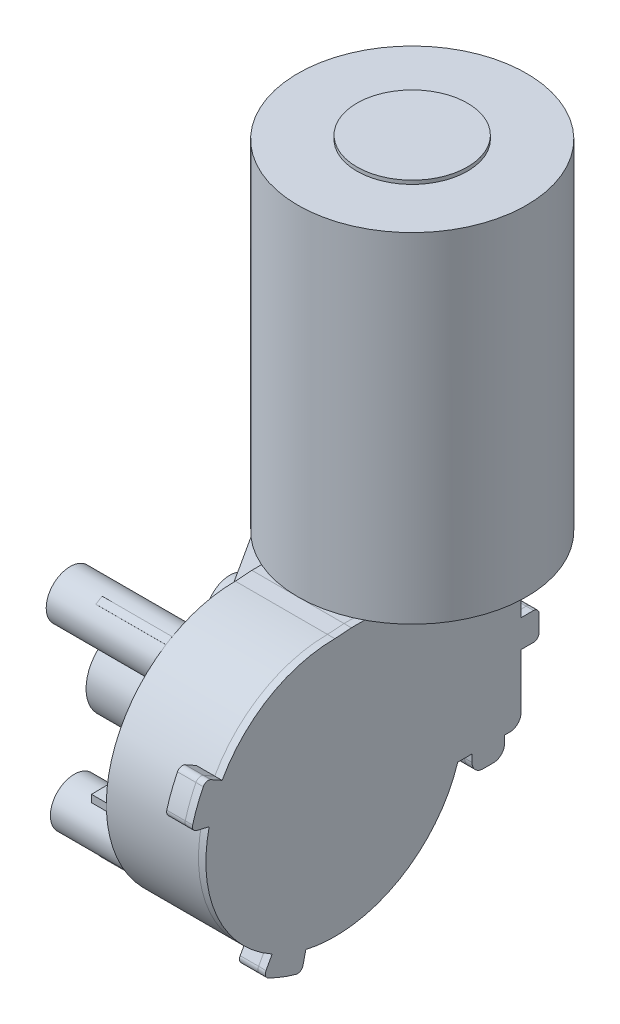
from build123d import *

# Parameters (mm, degrees)
ESBO_O2_R                     = 15
RESSALTO_EXTRUS_O1_DEPTH      = 1
EXTRUS_O_FINA2_OUTLINE_R      = 15
EXTRUS_O_FINA2_DEPTH          = 2
EXTRUS_O_FINA2_START          = 6
EXTRUS_O_FINA2_2_OUTLINE_R    = 15
EXTRUS_O_FINA2_2_DEPTH        = 2
EXTRUS_O_FINA2_START_2        = 2
EXTRUS_O_FINA2_3_OUTLINE_R    = 15
EXTRUS_O_FINA2_3_OUTLINE_R_2  = 13
EXTRUS_O_FINA2_3_DEPTH        = 4
RESSALTO_EXTRUS_O2_DEPTH      = 12.5
RESSALTO_EXTRUS_O2_DEPTH_BACK = 12.5
FILETE1_R                     = 15
ESBO_O6_R                     = 27
ESBO_O6_R_2                   = 25
EXTRUS_O_FINA3_DEPTH          = 4
ESBO_O7_R                     = 3
RESSALTO_EXTRUS_O3_DEPTH      = 4
EXTRUS_O_FINA4_DEPTH          = 4
PADR_OCIRCULAR1_COUNT         = 3
ESBO_O9_R                     = 10.5
RESSALTO_EXTRUS_O4_DEPTH      = 30
EXTRUS_O_FINA6_DEPTH          = 19
PADR_OCIRCULAR2_COUNT         = 3
ESBO_O11_R                    = 6.5
RESSALTO_EXTRUS_O6_DEPTH      = 30
ESBO_O16_R                    = 2.5
CORTE_EXTRUS_O2_DEPTH         = 25
RESSALTO_EXTRUS_O7_DEPTH      = 8
RESSALTO_EXTRUS_O7_DEPTH_BACK = 8
ESBO_O18_W                    = 17.091464814
ESBO_O18_H                    = 8.826934747
RESSALTO_EXTRUS_O8_DEPTH      = 5
FILETE2_R                     = 5
FILETE3_R                     = 3
FILETE4_R                     = 3
ESBO_O19_R                    = 2
CORTE_EXTRUS_O3_DEPTH         = 5
RESSALTO_EXTRUS_O10_START     = -5
RESSALTO_EXTRUS_O10_DEPTH     = 5
FILETE5_R                     = 1.5
ESBO_O21_W                    = 5
ESBO_O21_H                    = 7.5
RESSALTO_EXTRUS_O11_DEPTH     = 5
FILETE6_R                     = 1.5
RESSALTO_EXTRUS_O12_DEPTH     = 2
ESBO_O23_R                    = 5
CORTE_EXTRUS_O4_DEPTH         = 42


# Read off the part's stored shape, not the designer's step: Extrusão-Fina1, Extrusão-Fina2
with BuildPart() as part:
    # Extrusão-Fina1 outline → Extrusão-Fina1 (revolve)
    with BuildSketch(Plane.XY):
        Polygon((31, 92), (0, 92), (0, 82), (29, 82), (29, 10), (0, 10), (0, 0), (31, 0), align=None)
    revolve(axis=Axis((0, 0, 0), (0, 1, 0)))

    # Esboço2 → Ressalto-extrusão1 (add)
    with BuildSketch(Plane(origin=(0, 92, 0), x_dir=(1, 0, 0), z_dir=(0, 1, 0))):
        with Locations(Location((0, 0, 0), (0, 0, 270))):
            Circle(ESBO_O2_R)
    extrude(amount=RESSALTO_EXTRUS_O1_DEPTH)

    # Extrusão-Fina2 outline → Extrusão-Fina2 (add)
    with BuildSketch(Plane.XZ):
        Circle(EXTRUS_O_FINA2_OUTLINE_R)
    extrude(amount=EXTRUS_O_FINA2_DEPTH)



with BuildPart() as body_2:
    # Extrus_o-Fina2 2 outline → Extrus_o-Fina2 2 (new body)
    with BuildSketch(Plane.XZ.offset(EXTRUS_O_FINA2_START)):
        Circle(EXTRUS_O_FINA2_2_OUTLINE_R)
    extrude(amount=EXTRUS_O_FINA2_2_DEPTH)


with BuildPart() as part_1:
    add(part.part)

    add(body_2.part)  # Extrus_o-Fina2 3 merges body 2
    # Extrus_o-Fina2 3 outline → Extrus_o-Fina2 3 (add)
    with BuildSketch(Plane.XZ.offset(EXTRUS_O_FINA2_START_2)):
        Circle(EXTRUS_O_FINA2_3_OUTLINE_R)
        Circle(EXTRUS_O_FINA2_3_OUTLINE_R_2, mode=Mode.SUBTRACT)
    extrude(amount=EXTRUS_O_FINA2_3_DEPTH)

    # Esboço5 → Ressalto-extrusão2 (add, two sides: drawn at the far end of the back side and taken through both)
    with BuildSketch(Plane(origin=(0, 0, 0), x_dir=(0, 0, -1), z_dir=(1, 0, 0)).offset(-RESSALTO_EXTRUS_O2_DEPTH_BACK)):
        with BuildLine():
            Line((15, 0), (15, -46))
            Line((15, -46), (-2.140030554, -46))
            ThreePointArc((-2.140030554, -46), (-63.744394689, -55.946308734), (-35.469913586, -0.317355334))
            Line((-35.469913586, -0.317355334), (-31, 0))
            Line((-31, 0), (15, 0))
        make_face()
    extrude(amount=RESSALTO_EXTRUS_O2_DEPTH + RESSALTO_EXTRUS_O2_DEPTH_BACK)

    # Filete1
    # the kernel refuses this fillet: 15 mm, written as the material it takes off along each edge
    with BuildSketch(Plane(origin=(-12.5, 0, -15), x_dir=(0, 0, 1), z_dir=(0, -1, 0))) as filete1_piece_1_section:
        with BuildLine():
            CenterArc((FILETE1_R, -FILETE1_R), FILETE1_R, 90, 90)
            Line((0, -FILETE1_R), (0, 0))
            Line((0, 0), (FILETE1_R, 0))
        make_face()
    filete1_piece_1 = extrude(amount=83.5, mode=Mode.PRIVATE)
    filete1_piece_1 = filete1_piece_1 - Plane(origin=(0, -1, 0), x_dir=(1, 0, 0), z_dir=(0, 1, 0)) * Cylinder(15, 227, mode=Mode.PRIVATE)
    add(filete1_piece_1, mode=Mode.SUBTRACT)
    with BuildSketch(Plane(origin=(-12.5, 37.5, -15), x_dir=(0, 0, 1), z_dir=(0, -1, 0))) as filete1_piece_2_section:
        with BuildLine():
            CenterArc((FILETE1_R, -FILETE1_R), FILETE1_R, 90, 90)
            Line((0, -FILETE1_R), (0, 0))
            Line((0, 0), (FILETE1_R, 0))
        make_face()
    filete1_piece_2 = extrude(amount=121, mode=Mode.PRIVATE)
    filete1_piece_2 = split(filete1_piece_2, bisect_by=Plane(origin=(-11.836709573, -8, -4.574034317), z_dir=(0, -1, 0)), keep=Keep.TOP, mode=Mode.PRIVATE)
    add(filete1_piece_2, mode=Mode.SUBTRACT)

    # Esboço6 → Extrusão-Fina3 (add)
    with BuildSketch(Plane.ZY.offset(12.5)):
        with Locations((35.469913586, -35.317355334)):
            Circle(ESBO_O6_R)
        with Locations((35.469913586, -35.317355334)):
            Circle(ESBO_O6_R_2, mode=Mode.SUBTRACT)
    extrude(amount=EXTRUS_O_FINA3_DEPTH)

    # Esboço7 → Ressalto-extrusão3 (add)
    with BuildSketch(Plane.ZY.offset(12.5)):
        with Locations((35.469913586, -9.317355334)):
            Circle(ESBO_O7_R)
        with Locations((57.986574084, -22.317355334)):
            Circle(ESBO_O7_R)
        with Locations((57.986574084, -48.317355334)):
            Circle(ESBO_O7_R)
        with Locations((35.469913586, -61.317355334)):
            Circle(ESBO_O7_R)
        with Locations((12.953253088, -48.317355334)):
            Circle(ESBO_O7_R)
        with Locations((12.953253088, -22.317355334)):
            Circle(ESBO_O7_R)
    extrude(amount=RESSALTO_EXTRUS_O3_DEPTH)

    # Esboço8 → Extrusão-Fina4 (add)
    with BuildSketch(Plane.ZY.offset(12.5)):
        Polygon((34.612130521, -34.803343454), (16.62171471, -64.825750735), (18.33728084, -65.853774496), (36.327696651, -35.831367215), align=None)
    extrus_o_fina4 = extrude(amount=EXTRUS_O_FINA4_DEPTH)

    # PadrãoCircular1: Extrusão-Fina4 ×3 about axis
    padr_ocircular1_axis = Axis((0, -35.317355334, 35.469913586), (1, 0, 0))
    for i in range(1, PADR_OCIRCULAR1_COUNT):
        add(extrus_o_fina4.rotate(padr_ocircular1_axis, i * 360 / PADR_OCIRCULAR1_COUNT))

    # Esboço9 → Ressalto-extrusão4 (add)
    with BuildSketch(Plane.ZY.offset(12.5)):
        with Locations(Location((35.469913586, -35.317355334, 0), (0, 0, 233.603545663))):
            Circle(ESBO_O9_R)
    extrude(amount=RESSALTO_EXTRUS_O4_DEPTH)

    # Esboço10 → Extrusão-Fina6 (add)
    with BuildSketch(Plane.ZY.offset(12.5)):
        Polygon((34.595874707, -35.80321132), (51.60083419, -66.394572077), (53.348911947, -65.422860107), (36.343952465, -34.831499349), align=None)
    extrus_o_fina6 = extrude(amount=EXTRUS_O_FINA6_DEPTH)

    # PadrãoCircular2: Extrusão-Fina6 ×3 about axis
    padr_ocircular2_axis = Axis((0, -35.317355334, 35.469913586), (1, 0, 0))
    for i in range(1, PADR_OCIRCULAR2_COUNT):
        add(extrus_o_fina6.rotate(padr_ocircular2_axis, i * 360 / PADR_OCIRCULAR2_COUNT))

    # Esboço11 → Ressalto-extrusão6 (add)
    with BuildSketch(Plane.ZY.offset(12.5)):
        with Locations(Location((6.976730962, -34.666369322, 0), (0, 0, 179.068569462))):
            Circle(ESBO_O11_R)
        with Locations(Location((50.280275322, -10.967028353, 0), (0, 0, 186.971902932))):
            Circle(ESBO_O11_R)
        with Locations(Location((49.152734474, -60.318668328, 0), (0, 0, 188.886236416))):
            Circle(ESBO_O11_R)
    extrude(amount=RESSALTO_EXTRUS_O6_DEPTH)

    # Esboço16 → Corte-extrusão2 (cut)
    with BuildSketch(Plane.ZY.offset(42.5)):
        with Locations((6.976730962, -34.666369322)):
            Circle(ESBO_O16_R)
        with Locations((50.280275322, -10.967028353)):
            Circle(ESBO_O16_R)
        with Locations((49.152734474, -60.318668328)):
            Circle(ESBO_O16_R)
    extrude(amount=-CORTE_EXTRUS_O2_DEPTH, mode=Mode.SUBTRACT)

    # Esboço17 → Ressalto-extrusão7 (add, two sides: drawn at the far end of the back side and taken through both)
    with BuildSketch(Plane.ZY.offset(16.5).offset(-RESSALTO_EXTRUS_O7_DEPTH_BACK)):
        with BuildLine():
            Line((29.517575564, -26.6675188), (14.522358161, 0))
            Line((14.522358161, 0), (16.982007769, 0))
            Line((16.982007769, 0), (31.265653321, -25.69580683))
            ThreePointArc((31.265653321, -25.69580683), (30.368425741, -26.139947107), (29.517575564, -26.6675188))
        make_face()
    extrude(amount=RESSALTO_EXTRUS_O7_DEPTH + RESSALTO_EXTRUS_O7_DEPTH_BACK)

    # Esboço18 → Ressalto-extrusão8 (add)
    with BuildSketch(Plane.XZ.offset(46)):
        with Locations((3.954267593, -6.133180133)):
            Rectangle(ESBO_O18_W, ESBO_O18_H)
    extrude(amount=RESSALTO_EXTRUS_O8_DEPTH)

    # Filete2
    # the kernel refuses this fillet: 5 mm, written as the material it takes off along each edge
    with BuildSketch(Plane(origin=(-4.591464814, -46, -1.719712759), x_dir=(1, 0, 0), z_dir=(0, -1, 0)), Plane(origin=(-4.591464814, -46, -10.546647506), x_dir=(0, 0, 1), z_dir=(0, -1, 0))) as filete2_piece_1:
        with BuildLine():
            CenterArc((FILETE2_R, -FILETE2_R), FILETE2_R, 90, 90)
            Line((0, -FILETE2_R), (0, 0))
            Line((0, 0), (FILETE2_R, 0))
        make_face()
    extrude(amount=17.5, mode=Mode.SUBTRACT)

    # Filete3
    # the kernel refuses this fillet: 3 mm, written as the material it takes off along each edge
    with BuildSketch(Plane(origin=(20, -51, -1.719712759), x_dir=(0, 0, -1), z_dir=(-1, 0, 0))) as filete3_piece_1:
        with BuildLine():
            CenterArc((FILETE3_R, -FILETE3_R), FILETE3_R, 90, 90)
            Line((0, -FILETE3_R), (0, 0))
            Line((0, 0), (FILETE3_R, 0))
        make_face()
    extrude(amount=19.591464814, mode=Mode.SUBTRACT)
    with BuildSketch(Plane(origin=(0.408535186, -51, -10.546647506), x_dir=(0, 1, 0), z_dir=(1, 0, 0))) as filete3_piece_2:
        with BuildLine():
            CenterArc((FILETE3_R, FILETE3_R), FILETE3_R, 180, 90)
            Line((0, FILETE3_R), (0, 0))
            Line((0, 0), (FILETE3_R, 0))
        make_face()
    extrude(amount=19.591464814, mode=Mode.SUBTRACT)
    with BuildSketch(Plane(origin=(0.408535186, -51, -5.546647506), x_dir=(0, 0, -1), z_dir=(1, 0, 0))) as filete3_piece_3:
        with BuildLine():
            CenterArc((5 - FILETE3_R, FILETE3_R), FILETE3_R, 270, 90)
            Line((5, FILETE3_R), (5, 0))
            Line((5, 0), (5 - FILETE3_R, 0))
        make_face()
    revolve(axis=Axis((0.408535186, -51, -5.546647506), (0, 1, 0)), revolution_arc=169.236537509, mode=Mode.SUBTRACT)
    with BuildSketch(Plane(origin=(0.408535186, -51, -6.719712759), x_dir=(-0.18675487212016142, 0, -0.9824065440230851), z_dir=(0.9824065440230851, 0, -0.18675487212016142))) as filete3_piece_4:
        with BuildLine():
            CenterArc((5 - FILETE3_R, FILETE3_R), FILETE3_R, 270, 90)
            Line((5, FILETE3_R), (5, 0))
            Line((5, 0), (5 - FILETE3_R, 0))
        make_face()
    revolve(axis=Axis((0.408535186, -51, -6.719712759), (0, 1, 0)), revolution_arc=169.236537509, mode=Mode.SUBTRACT)

    # Filete4
    filete4_edges = [part_1.edges().sort_by_distance(p)[0] for p in [
        (-12.5, -46, 1.070015277),
        (7.5, -46, -15),
        (-8.106601718, -46, -10.606601718),
    ]]
    fillet(filete4_edges, radius=FILETE4_R)

    # Esboço19 → Corte-extrusão3 (cut)
    with BuildSketch(Plane.XZ):
        with Locations(Location((25.861460065, 0, 0), (0, 0, 270))):
            Circle(ESBO_O19_R)
        with Locations(Location((-25.861460065, 0, 0), (0, 0, 270))):
            Circle(ESBO_O19_R)
    extrude(amount=-CORTE_EXTRUS_O3_DEPTH, mode=Mode.SUBTRACT)

    # Esboço20 → Ressalto-extrusão10 (add)
    with BuildSketch(Plane(origin=(12.5, 0, 0), x_dir=(0, 0, -1), z_dir=(1, 0, 0)).offset(RESSALTO_EXTRUS_O10_START)):
        with BuildLine():
            Line((-43.345093867, -69.419870426), (-44.470119622, -74.291658296))
            ThreePointArc((-44.470119622, -74.291658296), (-49.82801089, -72.651589515), (-54.904152995, -70.278910486))
            Line((-54.904152995, -70.278910486), (-52.474873069, -65.908716092))
            ThreePointArc((-52.474873069, -65.908716092), (-48.033248727, -67.984810242), (-43.345093867, -69.419870426))
        make_face()
        with BuildLine():
            Line((-69.572428677, -27.442175053), (-74.444216547, -26.317149299))
            ThreePointArc((-74.444216547, -26.317149299), (-72.804147766, -20.959258031), (-70.431468737, -15.883115926))
            Line((-70.431468737, -15.883115926), (-66.061274343, -18.312395852))
            ThreePointArc((-66.061274343, -18.312395852), (-68.137368494, -22.754020194), (-69.572428677, -27.442175053))
        make_face()
    extrude(amount=RESSALTO_EXTRUS_O10_DEPTH)

    # Filete5
    filete5_edges = [part_1.edges().sort_by_distance(p)[0] for p in [
        (10, -74.291658296, 44.470119622),
        (10, -70.278910486, 54.904152995),
        (10, -26.317149299, 74.444216547),
        (10, -15.883115926, 70.431468737),
    ]]
    fillet(filete5_edges, radius=FILETE5_R)

    # Esboço21 → Ressalto-extrusão11 (add)
    with BuildSketch(Plane(origin=(12.5, 0, 0), x_dir=(0, 0, -1), z_dir=(1, 0, 0))):
        with Locations((17.416663772, -24.392553891)):
            Rectangle(ESBO_O21_W, ESBO_O21_H)
    extrude(amount=-RESSALTO_EXTRUS_O11_DEPTH)

    # Filete6
    filete6_edges = [part_1.edges().sort_by_distance(p)[0] for p in [
        (10, -20.642553891, -19.916663772),
        (10, -28.142553891, -19.916663772),
    ]]
    fillet(filete6_edges, radius=FILETE6_R)

    # Esboço23 → Corte-extrusão4 (cut)
    with BuildSketch(Plane.ZY.offset(42.5)):
        with Locations((35.469913586, -35.317355334)):
            Circle(ESBO_O23_R)
    extrude(amount=-CORTE_EXTRUS_O4_DEPTH, mode=Mode.SUBTRACT)


with BuildPart() as body_2_2:
    # Esboço22 → Ressalto-extrusão12 (new body)
    with BuildSketch(Plane(origin=(12.5, 0, 0), x_dir=(0, 0, -1), z_dir=(1, 0, 0))):
        with BuildLine():
            Line((15, -28.142553891), (18.416663772, -28.142553891))
            ThreePointArc((18.416663772, -28.142553891), (19.477323944, -27.703214062), (19.916663772, -26.642553891))
            Line((19.916663772, -26.642553891), (19.916663772, -22.142553891))
            ThreePointArc((19.916663772, -22.142553891), (19.477323944, -21.081893719), (18.416663772, -20.642553891))
            Line((18.416663772, -20.642553891), (15, -20.642553891))
            Line((15, -20.642553891), (15, 0))
            Line((15, 0), (8.291561976, 0))
            Line((8.291561976, 0), (8.291561976, -8))
            Line((8.291561976, -8), (-8.291561976, -8))
            Line((-8.291561976, -8), (-8.291561976, 0))
            Line((-8.291561976, 0), (-28.368115905, 0))
            Line((-28.368115905, 0), (-31, 0))
            Line((-31, 0), (-35.469913586, -0.317355334))
            ThreePointArc((-35.469913586, -0.317355334), (-53.215707709, -5.149710565), (-66.061274343, -18.312395852))
            Line((-66.061274343, -18.312395852), (-69.094860622, -16.626102386))
            ThreePointArc((-69.094860622, -16.626102386), (-70.263400344, -16.50307044), (-71.162101653, -17.260010264))
            ThreePointArc((-71.162101653, -17.260010264), (-72.804147766, -20.959258031), (-74.063967169, -24.805503545))
            ThreePointArc((-74.063967169, -24.805503545), (-73.904051158, -25.969569183), (-72.954197886, -26.661234348))
            Line((-72.954197886, -26.661234348), (-69.572428677, -27.442175053))
            ThreePointArc((-69.572428677, -27.442175053), (-67.452911948, -49.533114751), (-52.474873069, -65.908716092))
            Line((-52.474873069, -65.908716092), (-54.161166535, -68.942302371))
            ThreePointArc((-54.161166535, -68.942302371), (-54.284198481, -70.110842092), (-53.527258657, -71.009543401))
            ThreePointArc((-53.527258657, -71.009543401), (-49.82801089, -72.651589515), (-45.981765376, -73.911408917))
            ThreePointArc((-45.981765376, -73.911408917), (-44.817699738, -73.751492907), (-44.126034572, -72.801639634))
            Line((-44.126034572, -72.801639634), (-43.345093867, -69.419870426))
            ThreePointArc((-43.345093867, -69.419870426), (-18.17517289, -65.745827926), (-2.140030554, -46))
            Line((-2.140030554, -46), (1.719712759, -46))
            Line((1.719712759, -46), (1.719712759, -48))
            ThreePointArc((1.719712759, -48), (2.598392415, -50.121320344), (4.719712759, -51))
            Line((4.719712759, -51), (7.546647506, -51))
            ThreePointArc((7.546647506, -51), (9.66796785, -50.121320344), (10.546647506, -48))
            Line((10.546647506, -48), (10.546647506, -46))
            Line((10.546647506, -46), (12, -46))
            ThreePointArc((12, -46), (14.121320344, -45.121320344), (15, -43))
            Line((15, -43), (15, -28.142553891))
        make_face()
    extrude(amount=RESSALTO_EXTRUS_O12_DEPTH)


solid = Compound([part_1.part, body_2_2.part])
